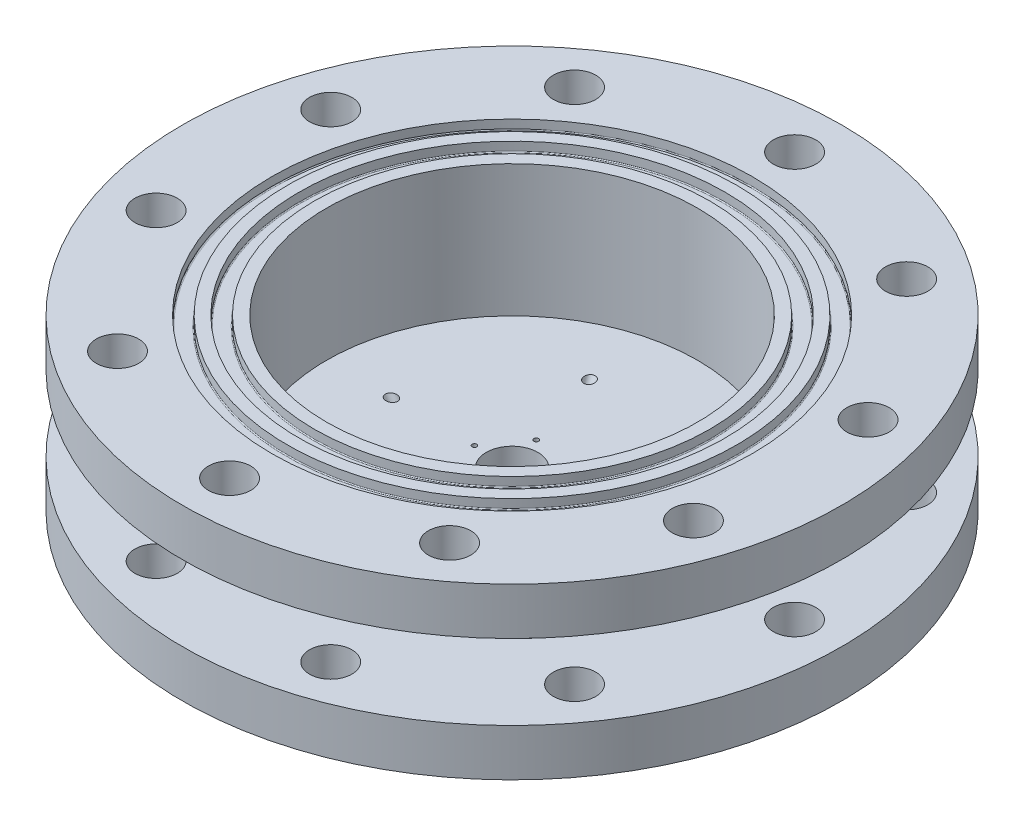
from build123d import *

# Parameters (mm, degrees)
FUEL_START                = -8
SKETCH2_R                 = 0.5
FUEL_HOLES_DEPTH          = 8
CIRPATTERN1_COUNT         = 5
SKETCH19_R                = 70
SKETCH19_R_2              = 47.4
BOSS_EXTRUDE2_DEPTH       = 10
SKETCH19_3_R              = 4
BOLT_HOLES_DEPTH          = 10
CUT_EXTRUDE7_START        = -10
SKETCH41_R                = 1.15
CUT_EXTRUDE7_DEPTH        = 111.877528587
SKETCH32_R                = 5.5
CUT_EXTRUDE3_DEPTH        = 8
CIRPATTERN6_START         = -8
CIRPATTERN6_OUTLINE_R     = 4
CIRPATTERN6_DEPTH         = 10
CIRPATTERN6_2_OUTLINE_R   = 70
CIRPATTERN6_2_OUTLINE_R_2 = 47.4
CIRPATTERN6_2_DEPTH       = 10
SKETCH33_R                = 4.5
CUT_EXTRUDE5_DEPTH        = 10
CIRPATTERN8_COUNT         = 10
SKETCH36_R                = 4.5
CUT_EXTRUDE6_DEPTH        = 10
CIRPATTERN9_COUNT         = 5


# Read off the part's stored shape, not the designer's step: CirPattern6
with BuildPart() as part:
    # Sketch1 → Revolve1 (revolve)
    with BuildSketch(Plane.XY, mode=Mode.PRIVATE) as revolve1_sk:
        Polygon((-47.4, 0), (-47.4, -8), (-17.4, -8), (-7, -8), (0, -8), (0, 0), align=None)
    revolve(revolve1_sk.sketch.rotate(Axis((0, -8, 0), (0, 1, 0)), 180), axis=Axis((0, -8, 0), (0, 1, 0)))

    # Sketch2 → Fuel holes (cut)
    with BuildSketch(Plane(origin=(0, 0, 0), x_dir=(1, 0, 0), z_dir=(0, 1, 0)).offset(FUEL_START)):
        with Locations(Location((-8, 0, 0), (0, 0, 180))):
            Circle(SKETCH2_R)
    fuel_holes = extrude(amount=FUEL_HOLES_DEPTH, mode=Mode.SUBTRACT)

    # CirPattern1: Fuel holes ×5 about axis
    cirpattern1_axis = Axis((0, 0, 0), (0, 1, 0))
    for i in range(1, CIRPATTERN1_COUNT):
        add(fuel_holes.rotate(cirpattern1_axis, i * 360 / CIRPATTERN1_COUNT), mode=Mode.SUBTRACT)

    # Sketch41 → Cut-Extrude7 (cut)
    with BuildSketch(Plane(origin=(-1.785898385, 3.09326674, 0), x_dir=(0, 0, -1), z_dir=(0.499999999999998, -0.8660254037844398, 0)).offset(CUT_EXTRUDE7_START)):
        with Locations(Location((0, -22.186533479, 0), (0, 0, 270))):
            Circle(SKETCH41_R)
    cut_extrude7 = extrude(amount=CUT_EXTRUDE7_DEPTH, mode=Mode.SUBTRACT)

    # Sketch32 → Cut-Extrude3 (cut)
    with BuildSketch(Plane(origin=(0, 0, 0), x_dir=(1, 0, 0), z_dir=(0, 1, 0))):
        with Locations(Location((0, 0, 0), (0, 0, 180))):
            Circle(SKETCH32_R)
    extrude(amount=-CUT_EXTRUDE3_DEPTH, mode=Mode.SUBTRACT)

    # CirPattern6 2 outline → CirPattern6 2 (add)
    with BuildSketch(Plane(origin=(0, 0, 0), x_dir=(1, 0, 0), z_dir=(0, 1, 0)).offset(CIRPATTERN6_START)):
        Circle(CIRPATTERN6_2_OUTLINE_R)
        Circle(CIRPATTERN6_2_OUTLINE_R_2, mode=Mode.SUBTRACT)
    extrude(amount=CIRPATTERN6_2_DEPTH)


with BuildPart() as body_2:
    # Sketch19 → Boss-Extrude2 (new body)
    with BuildSketch(Plane.XZ.offset(8)):
        with Locations(Location((0, 0, 0), (0, 0, 270))):
            Circle(SKETCH19_R)
        with Locations(Location((0, 0, 0), (0, 0, 270))):
            Circle(SKETCH19_R_2, mode=Mode.SUBTRACT)
    extrude(amount=-BOSS_EXTRUDE2_DEPTH)

    # Sketch19<3> → Bolt holes (cut)
    with BuildSketch(Plane.XZ.offset(8)):
        with Locations(Location((-60, 0, 0), (0, 0, 270))):
            Circle(SKETCH19_3_R)
    extrude(amount=-BOLT_HOLES_DEPTH, mode=Mode.SUBTRACT)

    # CirPattern6 outline → CirPattern6 (add)
    with BuildSketch(Plane(origin=(0, 0, 0), x_dir=(1, 0, 0), z_dir=(0, 1, 0)).offset(CIRPATTERN6_START)):
        with Locations((-60, 0)):
            Circle(CIRPATTERN6_OUTLINE_R)
    extrude(amount=CIRPATTERN6_DEPTH)


with BuildPart() as cut_extrude5_tool:
    # Sketch33 → Cut-Extrude5 (new body)
    with BuildSketch(Plane(origin=(0, 2, 0), x_dir=(1, 0, 0), z_dir=(0, 1, 0))):
        with Locations(Location((-60, 0, 0), (0, 0, 270))):
            Circle(SKETCH33_R)
    cut_extrude5 = extrude(amount=-CUT_EXTRUDE5_DEPTH)


with BuildPart() as part_1:
    add(part.part)

    # Cut-Extrude5: cut by cut_extrude5_tool
    add(cut_extrude5_tool.part, mode=Mode.SUBTRACT)


with BuildPart() as body_2_1:
    add(body_2.part)

    # Cut-Extrude5: cut by cut_extrude5_tool
    add(cut_extrude5_tool.part, mode=Mode.SUBTRACT)


with BuildPart() as cirpattern8_tool:
    # CirPattern8: Cut-Extrude5 ×10 about axis
    cirpattern8_axis = Axis((0, 0, 0), (0, 1, 0))
    for i in range(1, CIRPATTERN8_COUNT):
        add(cut_extrude5.rotate(cirpattern8_axis, i * 360 / CIRPATTERN8_COUNT))


with BuildPart() as part_2:
    add(part_1.part)

    # CirPattern8: cut by cirpattern8_tool
    add(cirpattern8_tool.part, mode=Mode.SUBTRACT)



with BuildPart() as body_2_2:
    add(body_2_1.part)

    # CirPattern8: cut by cirpattern8_tool
    add(cirpattern8_tool.part, mode=Mode.SUBTRACT)


with BuildPart() as part_3:
    add(part_2.part)

    add(body_2_2.part)  # Revolve2 merges body 2
    # Sketch34 → Revolve2 (revolve)
    with BuildSketch(Plane.XY, mode=Mode.PRIVATE) as revolve2_sk:
        with BuildLine():
            Line((-47.4, 0), (-39.4, 0))
            Line((-39.4, 0), (-39.4, 28))
            Line((-39.4, 28), (-42, 28))
            Line((-42, 28), (-42, 26.2))
            ThreePointArc((-42, 26.2), (-42.058578644, 26.058578644), (-42.2, 26))
            Line((-42.2, 26), (-45.05, 26))
            ThreePointArc((-45.05, 26), (-45.191421356, 26.058578644), (-45.25, 26.2))
            Line((-45.25, 26.2), (-45.25, 28))
            Line((-45.25, 28), (-47.75, 28))
            Line((-47.75, 28), (-47.75, 26.2))
            ThreePointArc((-47.75, 26.2), (-47.808578644, 26.058578644), (-47.95, 26))
            Line((-47.95, 26), (-50.8, 26))
            ThreePointArc((-50.8, 26), (-50.941421356, 26.058578644), (-51, 26.2))
            Line((-51, 26.2), (-51, 28))
            Line((-51, 28), (-70, 28))
            Line((-70, 28), (-70, 18))
            Line((-70, 18), (-47.4, 18))
            Line((-47.4, 18), (-47.4, 0))
        make_face()
    revolve(revolve2_sk.sketch.rotate(Axis((0, 0, 0), (0, 1, 0)), 270), axis=Axis((0, 0, 0), (0, 1, 0)))

    # Sketch36 → Cut-Extrude6 (cut)
    with BuildSketch(Plane(origin=(0, 28, 0), x_dir=(1, 0, 0), z_dir=(0, 1, 0))):
        with Locations(Location((35.267115138, 48.541019663, 0), (0, 0, 270))):
            Circle(SKETCH36_R)
        with Locations(Location((-35.267115138, 48.541019662, 0), (0, 0, 270))):
            Circle(SKETCH36_R)
        with Locations(Location((0, 60, 0), (0, 0, 270))):
            Circle(SKETCH36_R)
        with Locations(Location((-57.063390978, 18.541019662, 0), (0, 0, 270))):
            Circle(SKETCH36_R)
        with Locations(Location((-57.063390978, -18.541019663, 0), (0, 0, 270))):
            Circle(SKETCH36_R)
        with Locations(Location((57.063390978, 18.541019663, 0), (0, 0, 270))):
            Circle(SKETCH36_R)
        with Locations(Location((57.063390978, -18.541019662, 0), (0, 0, 270))):
            Circle(SKETCH36_R)
        with Locations(Location((35.267115138, -48.541019662, 0), (0, 0, 270))):
            Circle(SKETCH36_R)
        with Locations(Location((0, -60, 0), (0, 0, 270))):
            Circle(SKETCH36_R)
        with Locations(Location((-35.267115138, -48.541019663, 0), (0, 0, 270))):
            Circle(SKETCH36_R)
    extrude(amount=-CUT_EXTRUDE6_DEPTH, mode=Mode.SUBTRACT)

    # CirPattern9: Cut-Extrude7 ×5 about axis
    cirpattern9_axis = Axis((0, 0, 0), (0, 1, 0))
    for i in range(1, CIRPATTERN9_COUNT):
        add(cut_extrude7.rotate(cirpattern9_axis, i * 360 / CIRPATTERN9_COUNT), mode=Mode.SUBTRACT)


solid = part_3.part
